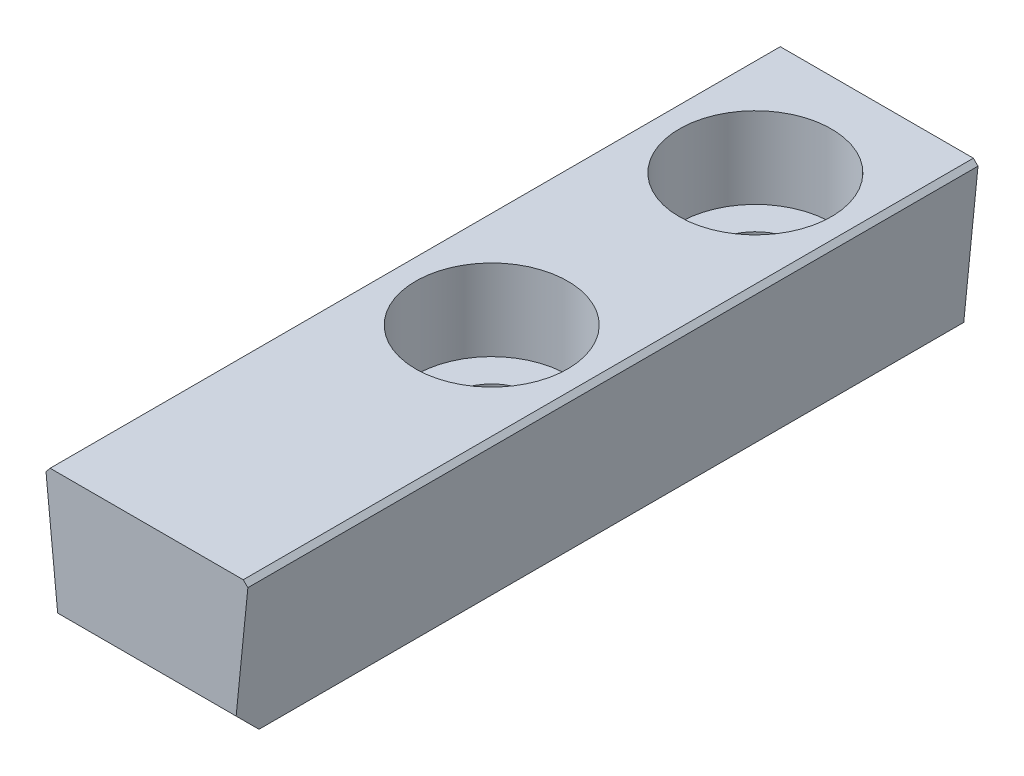
from build123d import *

# Parameters (mm, degrees)
EXTRUDE_1_DEPTH           = 72
CHAMFER_1_SIZE            = 3
CUT_EXTRUDE_1_DEPTH       = 75.222638056
CUT_EXTRUDE_1_DEPTH_BACK  = 0.5
SKETCH_2_W                = 17
SKETCH_2_H                = 2
HOLE_WIZARD_1_D           = 8.4
HOLE_WIZARD_1_CBORE_D     = 15
HOLE_WIZARD_1_CBORE_DEPTH = 8
CHAMFER_2_SIZE            = 0.5
CHAMFER_2_SIZE_2          = 0.558326423
CHAMFER_2_SIZE_3          = 0.456812528


with BuildPart() as part:
    # 草图1 → 凸台-拉伸1 (new body)
    with BuildSketch(Plane.XY):
        Polygon((-8.5, 0), (8.5, 0), (10, 15), (-10, 15), align=None)
    extrude(amount=-EXTRUDE_1_DEPTH)

    # 倒角1
    chamfer_1_edges = [part.edges().sort_by_distance(p)[0] for p in [
        (0, 0, 0),
    ]]
    chamfer(chamfer_1_edges, length=CHAMFER_1_SIZE)

    # 草图2 → 切除-拉伸-薄壁1 (cut, two sides: drawn at the far end of the back side and taken through both)
    with BuildSketch(Plane.XZ.offset(-CUT_EXTRUDE_1_DEPTH_BACK)):
        with Locations((0, -21)):
            Rectangle(SKETCH_2_W, SKETCH_2_H)
    extrude(amount=CUT_EXTRUDE_1_DEPTH + CUT_EXTRUDE_1_DEPTH_BACK, mode=Mode.SUBTRACT)

    # 孔1 (through all)
    with Locations(Plane(origin=(0, 15, 0), x_dir=(1, 0, 0), z_dir=(0, 1, 0))):
        with Locations((0, 34), (0, 60)):
            CounterBoreHole(HOLE_WIZARD_1_D / 2, HOLE_WIZARD_1_CBORE_D / 2, HOLE_WIZARD_1_CBORE_DEPTH)

    # 倒角2
    # the kernel refuses this chamfer: 0.558326423, 0.5, 0.456812528 mm, written as the material it takes off along each edge
    with BuildSketch(Plane(origin=(-8.5, 0, -1.560537605), x_dir=(0.9995316374096256, -0.030602382541768988, 0), z_dir=(0, 0, -1))) as chamfer_2_piece_1:
        Polygon((CHAMFER_2_SIZE * 0.99953163741, -CHAMFER_2_SIZE * 0.0306023825418), (-CHAMFER_2_SIZE_2 * 0.129907624032, -CHAMFER_2_SIZE_2 * 0.991526101843), (0, 0), align=None)
    extrude(amount=19.87892479, mode=Mode.SUBTRACT)
    with BuildSketch(Plane(origin=(8.5, 0, -1.560537605), x_dir=(-0.9996983211362673, -0.024561488499858487, 0), z_dir=(0, 0, -1))) as chamfer_2_piece_2:
        Polygon((CHAMFER_2_SIZE_2 * 0.999698321845, CHAMFER_2_SIZE_2 * 0.0245614885173), (-CHAMFER_2_SIZE * 0.123913295356, CHAMFER_2_SIZE * 0.992293049071), (0, 0), align=None)
    extrude(amount=19.87892479, mode=Mode.SUBTRACT)
    with BuildSketch(Plane(origin=(8.5, 0, -20.560537605), x_dir=(0.12990762393949729, 0.9915261011402545, 0), z_dir=(0, 0, -1))) as chamfer_2_piece_3:
        Polygon((CHAMFER_2_SIZE * 0.99953163741, -CHAMFER_2_SIZE * 0.0306023825418), (-CHAMFER_2_SIZE_2 * 0.129907624032, -CHAMFER_2_SIZE_2 * 0.991526101843), (0, 0), align=None)
    extrude(amount=52.87892479, mode=Mode.SUBTRACT)
    with BuildSketch(Plane(origin=(-8.5, 0, -20.560537605), x_dir=(-0.1239132953563816, 0.9922930490706474, 0), z_dir=(0, 0, -1))) as chamfer_2_piece_4:
        Polygon((CHAMFER_2_SIZE_2 * 0.999698321845, CHAMFER_2_SIZE_2 * 0.0245614885173), (-CHAMFER_2_SIZE * 0.123913295356, CHAMFER_2_SIZE * 0.992293049071), (0, 0), align=None)
    extrude(amount=52.87892479, mode=Mode.SUBTRACT)
    # the kernel refuses this chamfer: 0.558326423, 0.5, 0.456812528 mm, written as the material it takes off along each edge
    with BuildSketch(Plane(origin=(-10, 15, 1.285841494), x_dir=(0.07210667854261384, -0.9973969254562359, 0), z_dir=(0, 0, -1)), Plane(origin=(10, 15, 1.285841494), x_dir=(-0.9996219169112968, 0.027495876610585647, 0), z_dir=(0, 0, -1))) as chamfer_2_2_piece_1:
        Polygon((CHAMFER_2_SIZE * 0.999621916911, -CHAMFER_2_SIZE * 0.0274958766106), (CHAMFER_2_SIZE_3 * 0.0721066785794, -CHAMFER_2_SIZE_3 * 0.997396925964), (0, 0), align=None)
    extrude(amount=74.571682988, mode=Mode.SUBTRACT)


solid = part.part
